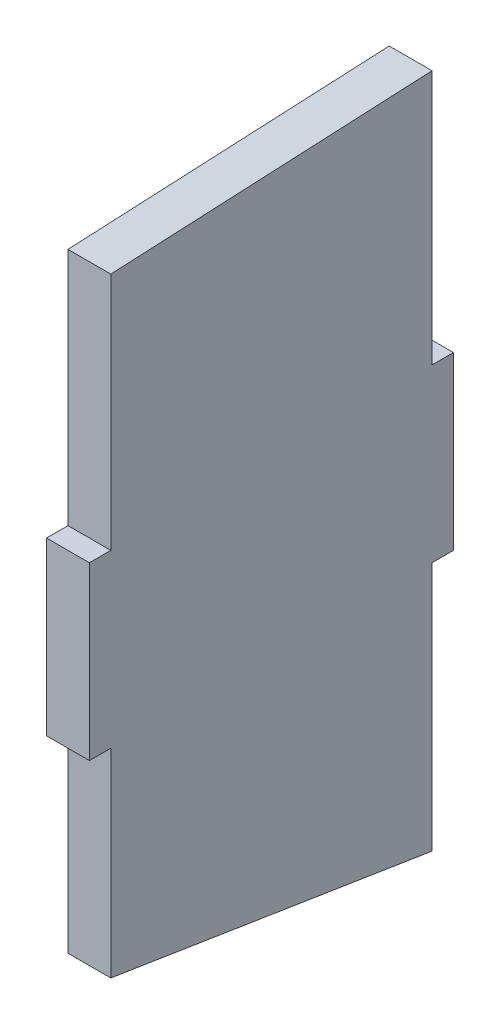
from build123d import *

# Parameters (mm, degrees)
BOSS_EXTRUDE1_DEPTH = 25.4


with BuildPart() as part:
    # Sketch1 → Boss-Extrude1 (new body)
    with BuildSketch(Plane(origin=(0, 0, 0), x_dir=(0, 0, -1), z_dir=(1, 0, 0))):
        Polygon((95.25, 201.879837032), (-95.25, 192.69579571), (-95.25, 50.8), (-107.95, 50.8), (-107.95, -50.8), (-95.25, -50.8), (-95.25, -168.80022374), (95.25, -198.895286486), (95.25, -50.8), (107.95, -50.8), (107.95, 50.8), (95.25, 50.8), align=None)
    extrude(amount=BOSS_EXTRUDE1_DEPTH)


solid = part.part
